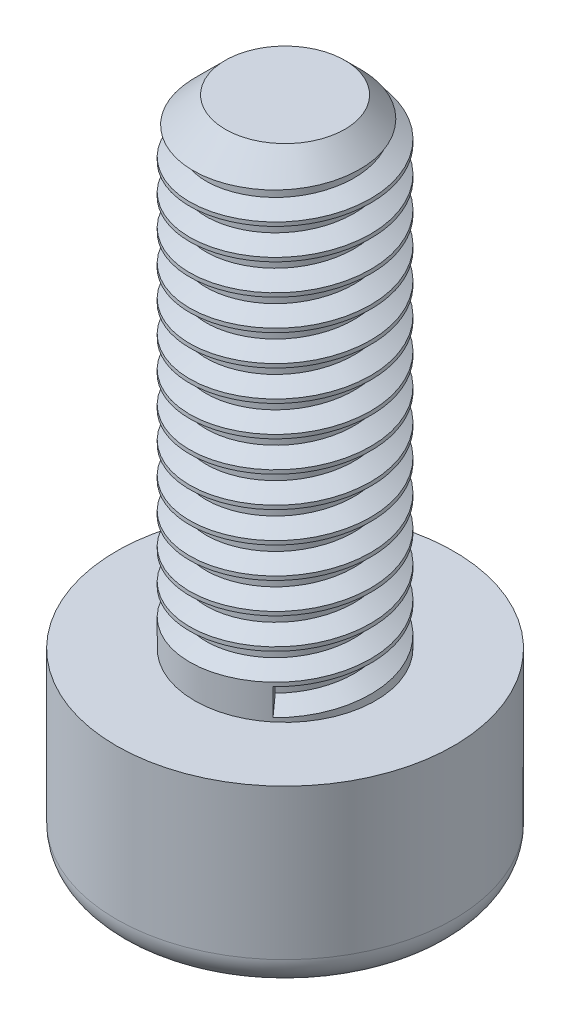
from build123d import *

# Parameters (mm, degrees)
SKETCH1_R           = 2.75
BOSS_EXTRUDE1_DEPTH = 2.95
SKETCH2_R           = 1.475
BOSS_EXTRUDE2_DEPTH = 7.82
CUT_EXTRUDE1_DEPTH  = 1.77
FILLET1_R           = 0.5
CHAMFER1_SIZE       = 0.5
THREAD1_PITCH       = 0.5


with BuildPart() as part:
    # Sketch1 → Boss-Extrude1 (new body)
    with BuildSketch(Plane(origin=(0, 0, 0), x_dir=(1, 0, 0), z_dir=(0, 1, 0))):
        with Locations(Location((0, 0, 0), (0, 0, 270))):
            Circle(SKETCH1_R)
    extrude(amount=BOSS_EXTRUDE1_DEPTH)

    # Sketch2 → Boss-Extrude2 (add)
    with BuildSketch(Plane(origin=(0, 2.95, 0), x_dir=(1, 0, 0), z_dir=(0, 1, 0))):
        with Locations(Location((0, 0, 0), (0, 0, 270))):
            Circle(SKETCH2_R)
    extrude(amount=BOSS_EXTRUDE2_DEPTH)

    # Sketch3 → Cut-Extrude1 (cut)
    with BuildSketch(Plane.XZ):
        Polygon((0, -1.443375673), (1.25, -0.721687836), (1.25, 0.721687836), (0, 1.443375673), (-1.25, 0.721687836), (-1.25, -0.721687836), align=None)
    extrude(amount=-CUT_EXTRUDE1_DEPTH, mode=Mode.SUBTRACT)

    # Fillet1
    fillet1_edges = [part.edges().sort_by_distance(p)[0] for p in [
        (0, 0, -2.75),
    ]]
    fillet(fillet1_edges, radius=FILLET1_R)

    # Chamfer1
    chamfer1_edges = [part.edges().sort_by_distance(p)[0] for p in [
        (0, 10.77, -1.475),
    ]]
    chamfer(chamfer1_edges, length=CHAMFER1_SIZE)

    # Thread1: arcs per turn and ends read off the stored shape
    # Thread1: the profile of Thread Profile1 profile screwed along a right-hand helix through 14.639997 turns, 6 arcs to a turn; built about Z, then put on its axis
    thread1_z = Axis((0, 0, 0), (0, 0, 1))
    thread1_corners = [(1.4753, 0, -0.000173205), (1.4753, 0, 0.437673204), (1.204367063, 0, 0.281249999), (1.204367063, 0, 0.156249999)]
    with BuildLine(mode=Mode.PRIVATE) as thread1_profile:
        Line(thread1_corners[0], thread1_corners[1])
        Line(thread1_corners[1], thread1_corners[2])
        Line(thread1_corners[2], thread1_corners[3])
        Line(thread1_corners[3], thread1_corners[0])
    thread1_cap = Face(thread1_profile.wire())
    thread1_turn_angles = [0, 30, 60, 90, 120, 150, 180, 210, 240, 270, 300, 330, 360]
    thread1_turn_weights = [1, 0.8660254037844387, 1, 0.8660254037844387, 1, 0.8660254037844387, 1, 0.8660254037844387, 1, 0.8660254037844387, 1, 0.8660254037844387, 1]
    thread1_turn_rails = [Edge.make_bspline([Vector(p[0], p[1], 0).rotate(thread1_z, thread1_turn_angles[k]) / thread1_turn_weights[k] + Vector(0, 0, p[2] + THREAD1_PITCH * thread1_turn_angles[k] / 360) for k in range(13)], [0, 0, 0, 1, 1, 2, 2, 3, 3, 4, 4, 5, 5, 6, 6, 6], 2, thread1_turn_weights) for p in thread1_corners]
    thread1_turn_sides = [Face.make_surface_from_curves(thread1_turn_rails[p[0]], thread1_turn_rails[p[1]]) for p in [(0, 1), (1, 2), (2, 3), (3, 0)]]
    thread1_last_angles = [5040, 5070, 5100, 5130, 5160, 5190, 5220, 5245.1995, 5270.399]
    thread1_last_weights = [1, 0.8660254037844387, 1, 0.8660254037844387, 1, 0.8660254037844387, 1, 0.9048307680568273, 1]
    thread1_last_rails = [Edge.make_bspline([Vector(p[0], p[1], 0).rotate(thread1_z, thread1_last_angles[k]) / thread1_last_weights[k] + Vector(0, 0, p[2] + THREAD1_PITCH * thread1_last_angles[k] / 360) for k in range(9)], [0, 0, 0, 1, 1, 2, 2, 3, 3, 4, 4, 4], 2, thread1_last_weights) for p in thread1_corners]
    thread1_last_sides = [Face.make_surface_from_curves(thread1_last_rails[p[0]], thread1_last_rails[p[1]]) for p in [(0, 1), (1, 2), (2, 3), (3, 0)]]
    thread1 = Plane(origin=(0, 10.77, 0), x_dir=(-1, 0, 0), z_dir=(0, -1, 0)) * Solid(Shell([*[p.moved(Location((0, 0, THREAD1_PITCH * i))) for i in range(14) for p in thread1_turn_sides], *thread1_last_sides, thread1_cap, thread1_cap.rotate(thread1_z, 5270.399).moved(Location((0, 0, THREAD1_PITCH * 5270.399 / 360)))]))
    add(thread1, mode=Mode.SUBTRACT)


solid = part.part
